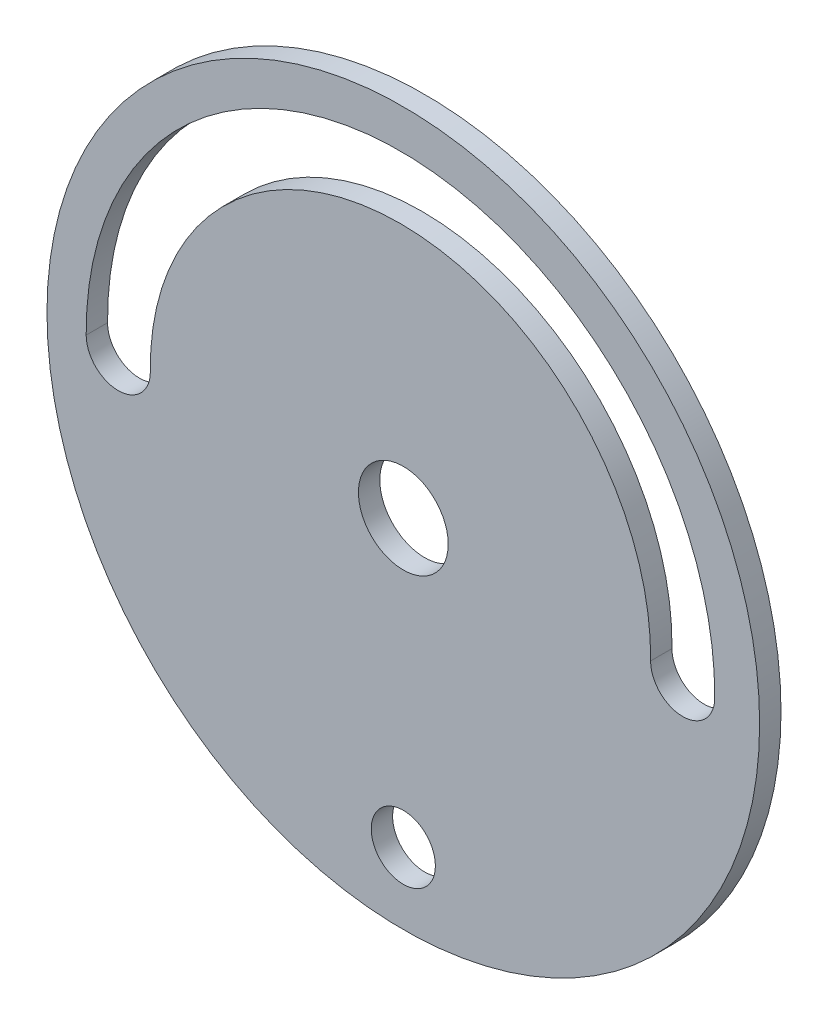
from build123d import *

# Parameters (mm, degrees)
SKETCH1_R           = 25
SKETCH1_R_2         = 2.25
SKETCH1_R_3         = 3.15
BOSS_EXTRUDE1_DEPTH = 1.5


with BuildPart() as part:
    # Sketch1 → Boss-Extrude1 (new body)
    with BuildSketch(Plane.XY):
        with Locations((-2.056478496, 7.394811009)):
            Circle(SKETCH1_R)
        with Locations((-2.056478496, -12.605188991)):
            Circle(SKETCH1_R_2, mode=Mode.SUBTRACT)
        with Locations((-2.056478496, 7.394811009)):
            Circle(SKETCH1_R_3, mode=Mode.SUBTRACT)
        with BuildLine():
            ThreePointArc((19.793521504, 7.394811009), (-2.256478496, 29.594811009), (-24.306478496, 7.394811009))
            ThreePointArc((-24.306478496, 7.394811009), (-22.056478496, 5.144811009), (-19.806478496, 7.394811009))
            ThreePointArc((-19.806478496, 7.394811009), (-2.256478496, 25.194811009), (15.293521504, 7.394811009))
            ThreePointArc((15.293521504, 7.394811009), (17.543521504, 5.144811009), (19.793521504, 7.394811009))
        make_face(mode=Mode.SUBTRACT)
    extrude(amount=BOSS_EXTRUDE1_DEPTH)


solid = part.part
